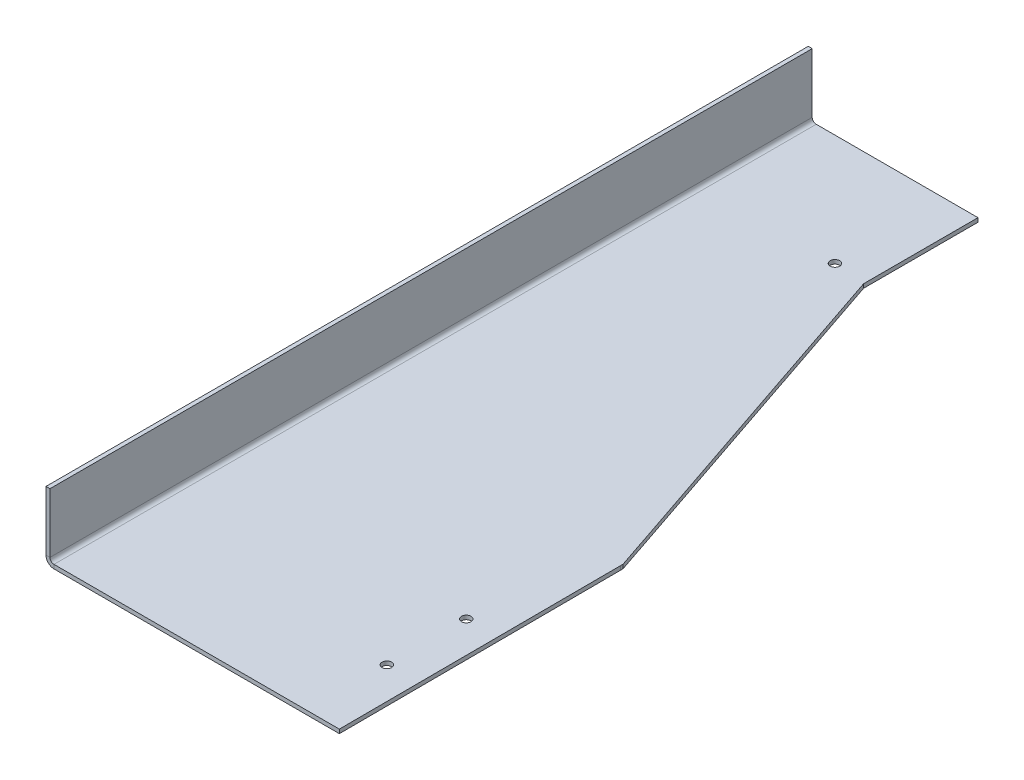
from build123d import *

# Parameters (mm, degrees)
BASE_FLANGE1_DEPTH           = 1.5875
EDGE_FLANGE1_STRIP_W         = 9.5504
EDGE_FLANGE1_STRIP_H         = 1.5875
EDGE_FLANGE1_STRIP_CUT_DEPTH = 304.8
EDGE_FLANGE1_DEPTH           = 304.8
CUT_EXTRUDE1_DEPTH           = 342.722050796
CUT_EXTRUDE1_DEPTH_BACK      = 342.722050796
F_6_CLEARANCE_HOLE1_D        = 3.7973


# Sheet-metal steps are written as plain solids
with BuildPart() as part:
    # Sketch1 → Base-Flange1 (new body)
    with BuildSketch(Plane(origin=(0, 0, 0), x_dir=(1, 0, 0), z_dir=(0, 1, 0))):
        Polygon((0, 304.8), (76.2, 304.8), (152.4, 0), (0, 0), align=None)
    extrude(amount=-BASE_FLANGE1_DEPTH)

    # Edge-Flange1 strip (across the edge) → Edge-Flange1 strip cut (cut)
    with BuildSketch(Plane.XY.offset(-304.8)):
        with Locations((-1.5875, -0.79375)):
            Rectangle(EDGE_FLANGE1_STRIP_W, EDGE_FLANGE1_STRIP_H)
    extrude(amount=EDGE_FLANGE1_STRIP_CUT_DEPTH, mode=Mode.SUBTRACT)

    # Edge-Flange1 section (across the edge) → Edge-Flange1 (add)
    with BuildSketch(Plane.XY.offset(-304.8)):
        with BuildLine():
            Line((0, 1.6002), (0, 25.4))
            Line((0, 25.4), (1.5875, 25.4))
            Line((1.5875, 25.4), (1.5875, 1.6002))
            ThreePointArc((1.5875, 1.6002), (2.056187729, 0.468687729), (3.1877, 0))
            Line((3.1877, 0), (3.1877, -1.5875))
            ThreePointArc((3.1877, -1.5875), (0.933655714, -0.653844286), (0, 1.6002))
        make_face()
    extrude(amount=EDGE_FLANGE1_DEPTH)

    # Sketch10 → Cut-Extrude1 (cut, two sides: drawn at the far end of the back side and taken through both)
    with BuildSketch(Plane(origin=(0, 0, 0), x_dir=(1, 0, 0), z_dir=(0, 1, 0)).offset(-CUT_EXTRUDE1_DEPTH_BACK)):
        Polygon((67.87676626, 967.988947135), (67.87676626, 304.8), (67.87676626, 261.217419128), (67.87676626, 259.06565424), (116.914364331, 113.849879077), (116.914364331, 112.848219234), (117.306905871, 0), (119.613788846, -663.184934911), (1445.325011297, -621.136473854), (1393.587988711, 1010.037408193), align=None)
    extrude(amount=CUT_EXTRUDE1_DEPTH + CUT_EXTRUDE1_DEPTH_BACK, mode=Mode.SUBTRACT)

    # #6 Clearance Hole1 (through all)
    with Locations(Plane(origin=(0, -1.5875, 0), x_dir=(-1, 0, 0), z_dir=(0, -1, 0))):
        with Locations((-55.118000004, 260.349999989), (-104.543184669, 31.750000016), (-104.543184669, 63.500000016)):
            Hole(F_6_CLEARANCE_HOLE1_D / 2)


solid = part.part
